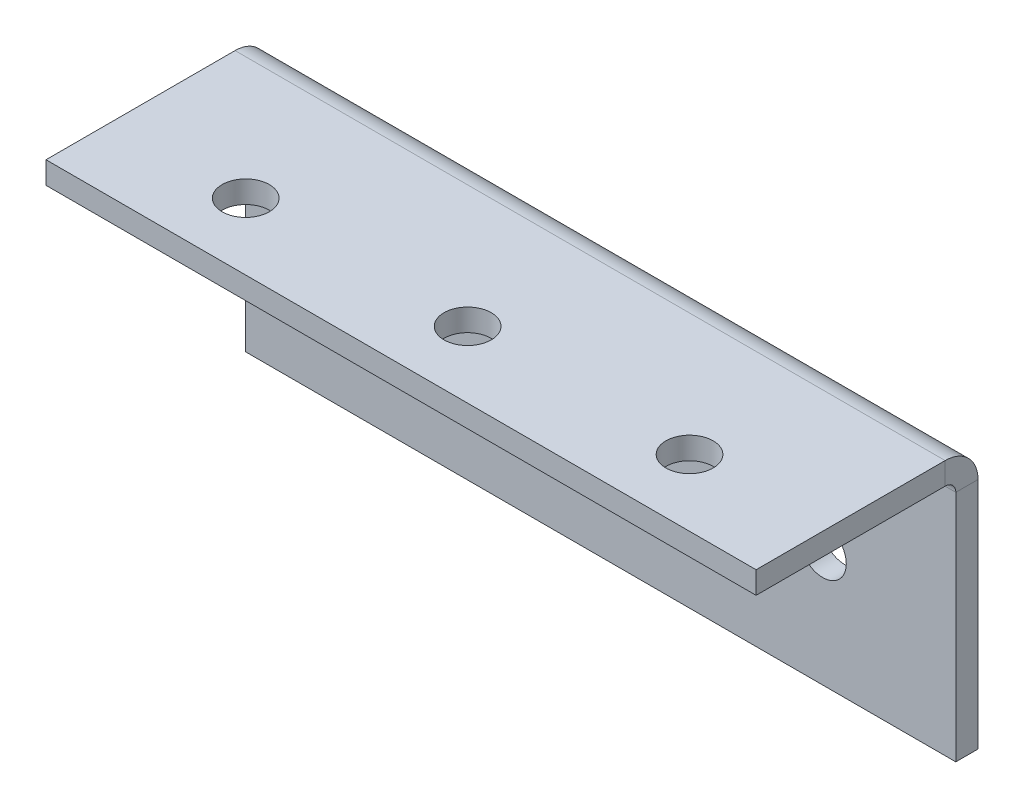
from build123d import *

# Parameters (mm, degrees)
SKETCH1_W                         = 101.6
SKETCH1_H                         = 38.1
BASE_FLANGE1_DEPTH                = 3.175
EDGE_FLANGE1_STRIP_W              = 15.748
EDGE_FLANGE1_STRIP_H              = 3.175
EDGE_FLANGE1_STRIP_CUT_DEPTH      = 101.6
EDGE_FLANGE1_DEPTH                = 101.6
F_1_4_CLEARANCE_HOLE1_D           = 6.7564
F_1_4_CLEARANCE_HOLE1_ON_FACE_2_D = 6.7564


# Sheet-metal steps are written as plain solids
with BuildPart() as part:
    # Sketch1 → Base-Flange1 (new body)
    with BuildSketch(Plane.XY):
        with Locations((50.8, 19.05)):
            Rectangle(SKETCH1_W, SKETCH1_H)
    extrude(amount=-BASE_FLANGE1_DEPTH)

    # Edge-Flange1 strip (across the edge) → Edge-Flange1 strip cut (cut)
    with BuildSketch(Plane(origin=(101.6, 38.1, 0), x_dir=(0, -1, 0), z_dir=(-1, 0, 0))):
        with Locations((-3.175, -1.5875)):
            Rectangle(EDGE_FLANGE1_STRIP_W, EDGE_FLANGE1_STRIP_H)
    extrude(amount=EDGE_FLANGE1_STRIP_CUT_DEPTH, mode=Mode.SUBTRACT)

    # Edge-Flange1 section (across the edge) → Edge-Flange1 (add)
    with BuildSketch(Plane(origin=(101.6, 38.1, 0), x_dir=(0, -1, 0), z_dir=(-1, 0, 0))):
        with BuildLine():
            Line((0, 1.524), (0, 28.575))
            Line((0, 28.575), (3.175, 28.575))
            Line((3.175, 28.575), (3.175, 1.524))
            ThreePointArc((3.175, 1.524), (3.621369265, 0.446369265), (4.699, 0))
            Line((4.699, 0), (4.699, -3.175))
            ThreePointArc((4.699, -3.175), (1.376305235, -1.798694765), (0, 1.524))
        make_face()
    extrude(amount=EDGE_FLANGE1_DEPTH)

    # 1/4 Clearance Hole1 (through all)
    with Locations(Plane(origin=(82.55, 16.7005, 0), x_dir=(1, 0, 0), z_dir=(0, 0, 1))):
        with Locations((0, 0), (-31.75, 0), (-63.5, 0)):
            Hole(F_1_4_CLEARANCE_HOLE1_D / 2)

    # 1/4 Clearance Hole1 on face 2 (through all)
    with Locations(Plane(origin=(82.55, 34.925, 19.05), x_dir=(0, 0, -1), z_dir=(0, -1, 0))):
        with Locations((0, 0), (0, -31.75), (0, -63.5)):
            Hole(F_1_4_CLEARANCE_HOLE1_ON_FACE_2_D / 2)


solid = part.part
